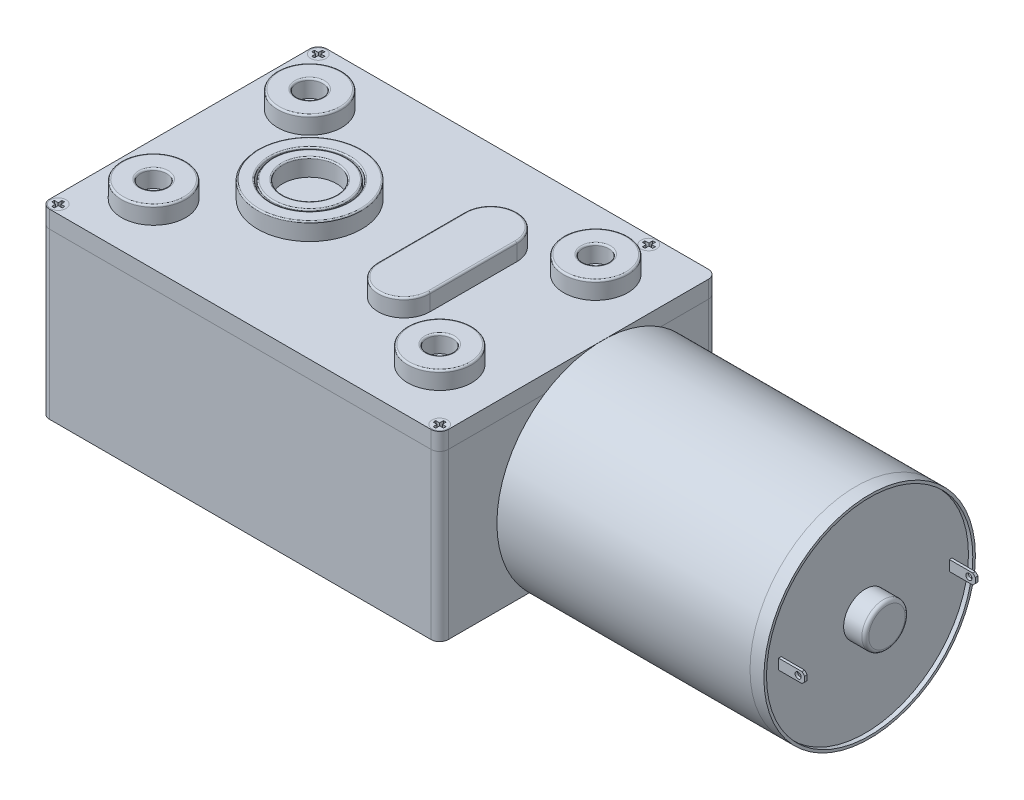
from build123d import *

# Parameters (mm, degrees)
CROQUIS1_W                = 46
CROQUIS1_H                = 32
SALIENTE_EXTRUIR1_DEPTH   = 20
REDONDEO1_R               = 1
CROQUIS2_R                = 12.2
SALIENTE_EXTRUIR2_DEPTH   = 30.8
CORTAR_EXTRUIR1_DEPTH     = 1
SALIENTE_EXTRUIR3_DEPTH   = 2
CROQUIS7_R                = 12.2
CORTAR_EXTRUIR2_DEPTH     = 1.6
CROQUIS8_R                = 12.2
SALIENTE_EXTRUIR4_DEPTH   = 1.6
CROQUIS9_R                = 2.5
SALIENTE_EXTRUIR5_DEPTH   = 2
CROQUIS10_R               = 11.9
CROQUIS10_R_2             = 2.5
CORTAR_EXTRUIR3_DEPTH     = 0.5
CROQUIS11_W               = 0.3
CROQUIS11_H               = 1.2
SALIENTE_EXTRUIR6_DEPTH   = 3
SALIENTE_EXTRUIR6_2_DEPTH = 3
CROQUIS12_R               = 0.35
CORTAR_EXTRUIR4_DEPTH     = 2.5
CROQUIS13_R               = 0.35
CORTAR_EXTRUIR5_DEPTH     = 2.5
REDONDEO2_R               = 0.4
CHAFL_N1_SIZE             = 0.3
CHAFL_N2_SIZE             = 0.3
CROQUIS14_R               = 0.89
CORTAR_EXTRUIR6_DEPTH     = 1
CROQUIS15_R               = 0.89
SALIENTE_EXTRUIR7_DEPTH   = 2
MATRIZL3_START            = 19
MATRIZL3_OUTLINE_R        = 0.89
MATRIZL3_DEPTH            = 2
MATRIZL3_2_OUTLINE_R      = 0.89
MATRIZL3_2_DEPTH          = 2
MATRIZL3_3_OUTLINE_R      = 0.89
MATRIZL3_3_DEPTH          = 2
MATRIZL3_START_2          = 20
MATRIZL3_4_OUTLINE_R      = 0.89
MATRIZL3_4_DEPTH          = 1
CROQUIS17_R               = 0.89
CORTAR_EXTRUIR7_DEPTH     = 1
CROQUIS19_R               = 0.89
SALIENTE_EXTRUIR9_DEPTH   = 0.99
CROQUIS20_R               = 3.7
CROQUIS20_R_2             = 1.5
SALIENTE_EXTRUIR10_DEPTH  = 2
REDONDEO3_R               = 0.2
MATRIZL13_COUNT           = 2
MATRIZL13_PITCH           = 33
MATRIZL13_COUNT_DIR2      = 2
MATRIZL13_PITCH_DIR2      = 18
REDONDEO3_OF_MATRIZL13_R  = 0.2
SALIENTE_EXTRUIR11_DEPTH  = 2
REDONDEO4_R               = 0.2
CROQUIS25_R               = 0.89
CORTAR_EXTRUIR9_DEPTH     = 1
CROQUIS26_R               = 0.89
SALIENTE_EXTRUIR12_DEPTH  = 2
CROQUIS27_R               = 6
CROQUIS27_R_2             = 4.5
SALIENTE_EXTRUIR13_DEPTH  = 2
CROQUIS28_R               = 4.3
CROQUIS28_R_2             = 3.1
SALIENTE_EXTRUIR14_DEPTH  = 2
REDONDEO5_R               = 0.15


# Read off the part's stored shape, not the designer's step: MatrizL3
with BuildPart() as part:
    # Croquis1 → Saliente-Extruir1 (new body)
    with BuildSketch(Plane(origin=(0, 0, 0), x_dir=(1, 0, 0), z_dir=(0, 1, 0))):
        Rectangle(CROQUIS1_W, CROQUIS1_H)
    extrude(amount=SALIENTE_EXTRUIR1_DEPTH)

    # Redondeo1
    redondeo1_edges = [part.edges().sort_by_distance(p)[0] for p in [
        (23, 10, 16),
        (-23, 10, 16),
        (-23, 10, -16),
        (23, 10, -16),
    ]]
    fillet(redondeo1_edges, radius=REDONDEO1_R)

    # Croquis3 → Cortar-Extruir1 (cut)
    with BuildSketch(Plane(origin=(0, 20, 0), x_dir=(1, 0, 0), z_dir=(0, 1, 0))):
        with BuildLine():
            Line((-22, -16), (22, -16))
            ThreePointArc((22, -16), (22.707106781, -15.707106781), (23, -15))
            Line((23, -15), (23, 15))
            ThreePointArc((23, 15), (22.707106781, 15.707106781), (22, 16))
            Line((22, 16), (-22, 16))
            ThreePointArc((-22, 16), (-22.707106781, 15.707106781), (-23, 15))
            Line((-23, 15), (-23, -15))
            ThreePointArc((-23, -15), (-22.707106781, -15.707106781), (-22, -16))
        make_face()
    extrude(amount=-CORTAR_EXTRUIR1_DEPTH, mode=Mode.SUBTRACT)


with BuildPart() as body_2:
    # Croquis2 → Saliente-Extruir2 (new body)
    with BuildSketch(Plane(origin=(23, 0, 0), x_dir=(0, 0, -1), z_dir=(1, 0, 0))):
        with Locations(Location((2.8, 8.8, 0), (0, 0, 180))):
            Circle(CROQUIS2_R)
    extrude(amount=SALIENTE_EXTRUIR2_DEPTH)

    # Croquis7 → Cortar-Extruir2 (cut)
    with BuildSketch(Plane(origin=(53.8, 0, 0), x_dir=(0, 0, -1), z_dir=(1, 0, 0))):
        with Locations(Location((2.8, 8.8, 0), (0, 0, 180))):
            Circle(CROQUIS7_R)
    extrude(amount=-CORTAR_EXTRUIR2_DEPTH, mode=Mode.SUBTRACT)


with BuildPart() as body_3:
    # Croquis5 → Saliente-Extruir3 (new body)
    with BuildSketch(Plane(origin=(0, 19, 0), x_dir=(1, 0, 0), z_dir=(0, 1, 0))):
        with BuildLine():
            Line((-22, 16), (22, 16))
            ThreePointArc((22, 16), (22.707106781, 15.707106781), (23, 15))
            Line((23, 15), (23, -15))
            ThreePointArc((23, -15), (22.707106781, -15.707106781), (22, -16))
            Line((22, -16), (-22, -16))
            ThreePointArc((-22, -16), (-22.707106781, -15.707106781), (-23, -15))
            Line((-23, -15), (-23, 15))
            ThreePointArc((-23, 15), (-22.707106781, 15.707106781), (-22, 16))
        make_face()
    extrude(amount=SALIENTE_EXTRUIR3_DEPTH)

    # Croquis14 → Cortar-Extruir6 (cut)
    with BuildSketch(Plane(origin=(0, 21, 0), x_dir=(1, 0, 0), z_dir=(0, 1, 0))):
        with Locations(Location((22, -15, 0), (0, 0, 270))):
            Circle(CROQUIS14_R)
    extrude(amount=-CORTAR_EXTRUIR6_DEPTH, mode=Mode.SUBTRACT)

    # MatrizL3 4 outline → MatrizL3 4 (cut)
    with BuildSketch(Plane(origin=(0, 0, 0), x_dir=(1, 0, 0), z_dir=(0, 1, 0)).offset(MATRIZL3_START_2)):
        with Locations((-22, 15)):
            Circle(MATRIZL3_4_OUTLINE_R)
        with Locations((-22, -15)):
            Circle(MATRIZL3_4_OUTLINE_R)
        with Locations((22, 15)):
            Circle(MATRIZL3_4_OUTLINE_R)
    extrude(amount=MATRIZL3_4_DEPTH, mode=Mode.SUBTRACT)

    # Croquis19 → Saliente-Extruir9 (add)
    with BuildSketch(Plane(origin=(0, 21, 0), x_dir=(1, 0, 0), z_dir=(0, 1, 0))):
        with Locations(Location((22, 15, 0), (0, 0, 270))):
            Circle(CROQUIS19_R)
    extrude(amount=-SALIENTE_EXTRUIR9_DEPTH)

    # Croquis20 → Saliente-Extruir10 (add)
    with BuildSketch(Plane(origin=(0, 21, 0), x_dir=(1, 0, 0), z_dir=(0, 1, 0))):
        with Locations(Location((16, -9, 0), (0, 0, 90))):
            Circle(CROQUIS20_R)
        with Locations(Location((16, -9, 0), (0, 0, 270))):
            Circle(CROQUIS20_R_2, mode=Mode.SUBTRACT)
    saliente_extruir10 = extrude(amount=SALIENTE_EXTRUIR10_DEPTH)

    # Redondeo3
    redondeo3_edges = [body_3.edges().sort_by_distance(p)[0] for p in [
        (16, 23, 12.7),
        (16, 23, 7.5),
    ]]
    fillet(redondeo3_edges, radius=REDONDEO3_R)

    # MatrizL13: Saliente-Extruir10 2 × 2
    with Locations(*[(-i * MATRIZL13_PITCH, 0, -j * MATRIZL13_PITCH_DIR2) for i in range(MATRIZL13_COUNT) for j in range(MATRIZL13_COUNT_DIR2) if (i, j) != (0, 0)]):
        add(saliente_extruir10)

    # Redondeo3 of MatrizL13
    redondeo3_of_matrizl13_edges = [body_3.edges().sort_by_distance(p)[0] for p in [
        (16, 23, -5.3),
        (16, 23, -10.5),
        (-17, 23, 12.7),
        (-17, 23, 7.5),
        (-17, 23, -5.3),
        (-17, 23, -10.5),
    ]]
    fillet(redondeo3_of_matrizl13_edges, radius=REDONDEO3_OF_MATRIZL13_R)

    # Croquis23 → Saliente-Extruir11 (add)
    with BuildSketch(Plane(origin=(0, 21, 0), x_dir=(1, 0, 0), z_dir=(0, 1, 0))):
        with BuildLine():
            Line((10.2, -4.30237879), (10.2, 5.69762121))
            ThreePointArc((10.2, 5.69762121), (7.2, 8.69762121), (4.2, 5.69762121))
            Line((4.2, 5.69762121), (4.2, -4.30237879))
            ThreePointArc((4.2, -4.30237879), (7.2, -7.30237879), (10.2, -4.30237879))
        make_face()
    extrude(amount=SALIENTE_EXTRUIR11_DEPTH)

    # Redondeo4
    redondeo4_edges = [body_3.edges().sort_by_distance(p)[0] for p in [
        (7.2, 23, -8.69762121),
        (4.2, 23, -0.69762121),
        (7.2, 23, 7.30237879),
        (10.2, 23, -0.69762121),
    ]]
    fillet(redondeo4_edges, radius=REDONDEO4_R)

    # Croquis25 → Cortar-Extruir9 (cut)
    with BuildSketch(Plane(origin=(0, 21, 0), x_dir=(1, 0, 0), z_dir=(0, 1, 0))):
        with Locations(Location((16.1, 15.03, 0), (0, 0, 270))):
            Circle(CROQUIS25_R)
    extrude(amount=-CORTAR_EXTRUIR9_DEPTH, mode=Mode.SUBTRACT)

    # Croquis27 → Saliente-Extruir13 (add)
    with BuildSketch(Plane(origin=(0, 21, 0), x_dir=(1, 0, 0), z_dir=(0, 1, 0))):
        with Locations(Location((-8, 0, 0), (0, 0, 90))):
            Circle(CROQUIS27_R)
        with Locations(Location((-8, 0, 0), (0, 0, 270))):
            Circle(CROQUIS27_R_2, mode=Mode.SUBTRACT)
    extrude(amount=SALIENTE_EXTRUIR13_DEPTH)

    # Croquis28 → Saliente-Extruir14 (add)
    with BuildSketch(Plane(origin=(0, 21, 0), x_dir=(1, 0, 0), z_dir=(0, 1, 0))):
        with Locations(Location((-8, 0, 0), (0, 0, 90))):
            Circle(CROQUIS28_R)
        with Locations(Location((-8, 0, 0), (0, 0, 270))):
            Circle(CROQUIS28_R_2, mode=Mode.SUBTRACT)
    extrude(amount=SALIENTE_EXTRUIR14_DEPTH)

    # Redondeo5
    redondeo5_edges = [body_3.edges().sort_by_distance(p)[0] for p in [
        (-8, 23, 6),
        (-8, 23, -4.5),
        (-8, 23, 4.3),
        (-8, 23, -3.1),
    ]]
    fillet(redondeo5_edges, radius=REDONDEO5_R)


with BuildPart() as body_4:
    # Croquis8 → Saliente-Extruir4 (new body)
    with BuildSketch(Plane(origin=(52.2, 0, 0), x_dir=(0, 0, -1), z_dir=(1, 0, 0))):
        with Locations((2.8, 8.8)):
            Circle(CROQUIS8_R)
    extrude(amount=SALIENTE_EXTRUIR4_DEPTH)

    # Croquis9 → Saliente-Extruir5 (add)
    with BuildSketch(Plane(origin=(53.8, 0, 0), x_dir=(0, 0, -1), z_dir=(1, 0, 0))):
        with Locations((2.8, 8.8)):
            Circle(CROQUIS9_R)
    extrude(amount=SALIENTE_EXTRUIR5_DEPTH)

    # Croquis10 → Cortar-Extruir3 (cut)
    with BuildSketch(Plane(origin=(53.8, 0, 0), x_dir=(0, 0, -1), z_dir=(1, 0, 0))):
        with Locations((2.8, 8.8)):
            Circle(CROQUIS10_R)
        with Locations((2.8, 8.8)):
            Circle(CROQUIS10_R_2, mode=Mode.SUBTRACT)
    extrude(amount=-CORTAR_EXTRUIR3_DEPTH, mode=Mode.SUBTRACT)

    # Redondeo2
    redondeo2_edges = [body_4.edges().sort_by_distance(p)[0] for p in [
        (55.8, 8.8, -0.3),
    ]]
    fillet(redondeo2_edges, radius=REDONDEO2_R)


with BuildPart() as body_5:
    # Croquis11 → Saliente-Extruir6 (new body)
    with BuildSketch(Plane(origin=(53.3, 0, 0), x_dir=(0, 0, -1), z_dir=(1, 0, 0))):
        with Locations((12.65, 8.8)):
            Rectangle(CROQUIS11_W, CROQUIS11_H)
    extrude(amount=SALIENTE_EXTRUIR6_DEPTH)

    # Croquis13 → Cortar-Extruir5 (cut)
    with BuildSketch(Plane.XY.offset(-12.5)):
        with Locations((55.55, 8.8)):
            Circle(CROQUIS13_R)
    extrude(amount=-CORTAR_EXTRUIR5_DEPTH, mode=Mode.SUBTRACT)

    # Chaflán1
    chafl_n1_edges = [body_5.edges().sort_by_distance(p)[0] for p in [
        (56.3, 9.4, -12.65),
        (56.3, 8.2, -12.65),
    ]]
    chamfer(chafl_n1_edges, length=CHAFL_N1_SIZE)


with BuildPart() as body_6:
    # Croquis11 → Saliente-Extruir6 2 (new body)
    with BuildSketch(Plane(origin=(53.3, 0, 0), x_dir=(0, 0, -1), z_dir=(1, 0, 0))):
        with Locations((-7.05, 8.8)):
            Rectangle(CROQUIS11_W, CROQUIS11_H)
    extrude(amount=SALIENTE_EXTRUIR6_2_DEPTH)

    # Croquis12 → Cortar-Extruir4 (cut)
    with BuildSketch(Plane.XY.offset(7.2)):
        with Locations((55.55, 8.8)):
            Circle(CROQUIS12_R)
    extrude(amount=-CORTAR_EXTRUIR4_DEPTH, mode=Mode.SUBTRACT)

    # Chaflán2
    chafl_n2_edges = [body_6.edges().sort_by_distance(p)[0] for p in [
        (56.3, 8.2, 7.05),
        (56.3, 9.4, 7.05),
    ]]
    chamfer(chafl_n2_edges, length=CHAFL_N2_SIZE)


with BuildPart() as body_7:
    # Croquis15 → Saliente-Extruir7 (new body)
    with BuildSketch(Plane(origin=(0, 19, 0), x_dir=(1, 0, 0), z_dir=(0, 1, 0))):
        with Locations(Location((22, -15, 0), (0, 0, 270))):
            Circle(CROQUIS15_R)
        Polygon((22.15, -15.6), (21.85, -15.6), (21.85, -15.15), (21.4, -15.15), (21.4, -14.85), (21.85, -14.85), (21.85, -14.4), (22.15, -14.4), (22.15, -14.85), (22.6, -14.85), (22.6, -15.15), (22.15, -15.15), align=None, mode=Mode.SUBTRACT)
    extrude(amount=SALIENTE_EXTRUIR7_DEPTH)


with BuildPart() as body_8:
    # MatrizL3 outline → MatrizL3 (new body)
    with BuildSketch(Plane(origin=(0, 0, 0), x_dir=(1, 0, 0), z_dir=(0, 1, 0)).offset(MATRIZL3_START)):
        with Locations((-22, 15)):
            Circle(MATRIZL3_OUTLINE_R)
        Polygon((-21.85, 15.15), (-21.4, 15.15), (-21.4, 14.85), (-21.85, 14.85), (-21.85, 14.4), (-22.15, 14.4), (-22.15, 14.85), (-22.6, 14.85), (-22.6, 15.15), (-22.15, 15.15), (-22.15, 15.6), (-21.85, 15.6), align=None, mode=Mode.SUBTRACT)
    extrude(amount=MATRIZL3_DEPTH)


with BuildPart() as body_9:
    # MatrizL3 2 outline → MatrizL3 2 (new body)
    with BuildSketch(Plane(origin=(0, 0, 0), x_dir=(1, 0, 0), z_dir=(0, 1, 0)).offset(MATRIZL3_START)):
        with Locations((-22, -15)):
            Circle(MATRIZL3_2_OUTLINE_R)
        Polygon((-21.85, -14.85), (-21.4, -14.85), (-21.4, -15.15), (-21.85, -15.15), (-21.85, -15.6), (-22.15, -15.6), (-22.15, -15.15), (-22.6, -15.15), (-22.6, -14.85), (-22.15, -14.85), (-22.15, -14.4), (-21.85, -14.4), align=None, mode=Mode.SUBTRACT)
    extrude(amount=MATRIZL3_2_DEPTH)


with BuildPart() as body_10:
    # MatrizL3 3 outline → MatrizL3 3 (new body)
    with BuildSketch(Plane(origin=(0, 0, 0), x_dir=(1, 0, 0), z_dir=(0, 1, 0)).offset(MATRIZL3_START)):
        with Locations((22, 15)):
            Circle(MATRIZL3_3_OUTLINE_R)
        Polygon((22.15, 15.15), (22.6, 15.15), (22.6, 14.85), (22.15, 14.85), (22.15, 14.4), (21.85, 14.4), (21.85, 14.85), (21.4, 14.85), (21.4, 15.15), (21.85, 15.15), (21.85, 15.6), (22.15, 15.6), align=None, mode=Mode.SUBTRACT)
    extrude(amount=MATRIZL3_3_DEPTH)

    # Croquis17 → Cortar-Extruir7 (cut)
    with BuildSketch(Plane(origin=(0, 21, 0), x_dir=(1, 0, 0), z_dir=(0, 1, 0))):
        with Locations(Location((22, 15, 0), (0, 0, 270))):
            Circle(CROQUIS17_R)
    extrude(amount=-CORTAR_EXTRUIR7_DEPTH, mode=Mode.SUBTRACT)


with BuildPart() as body_11:
    # Croquis26 → Saliente-Extruir12 (new body)
    with BuildSketch(Plane(origin=(0, 19, 0), x_dir=(1, 0, 0), z_dir=(0, 1, 0))):
        with Locations(Location((16.1, 15.03, 0), (0, 0, 270))):
            Circle(CROQUIS26_R)
        Polygon((16.25, 14.43), (15.95, 14.43), (15.95, 14.88), (15.5, 14.88), (15.5, 15.18), (15.95, 15.18), (15.95, 15.63), (16.25, 15.63), (16.25, 15.18), (16.7, 15.18), (16.7, 14.88), (16.25, 14.88), align=None, mode=Mode.SUBTRACT)
    extrude(amount=SALIENTE_EXTRUIR12_DEPTH)


solid = Compound([part.part, body_2.part, body_3.part, body_4.part, body_5.part, body_6.part, body_7.part, body_8.part, body_9.part, body_10.part, body_11.part])
